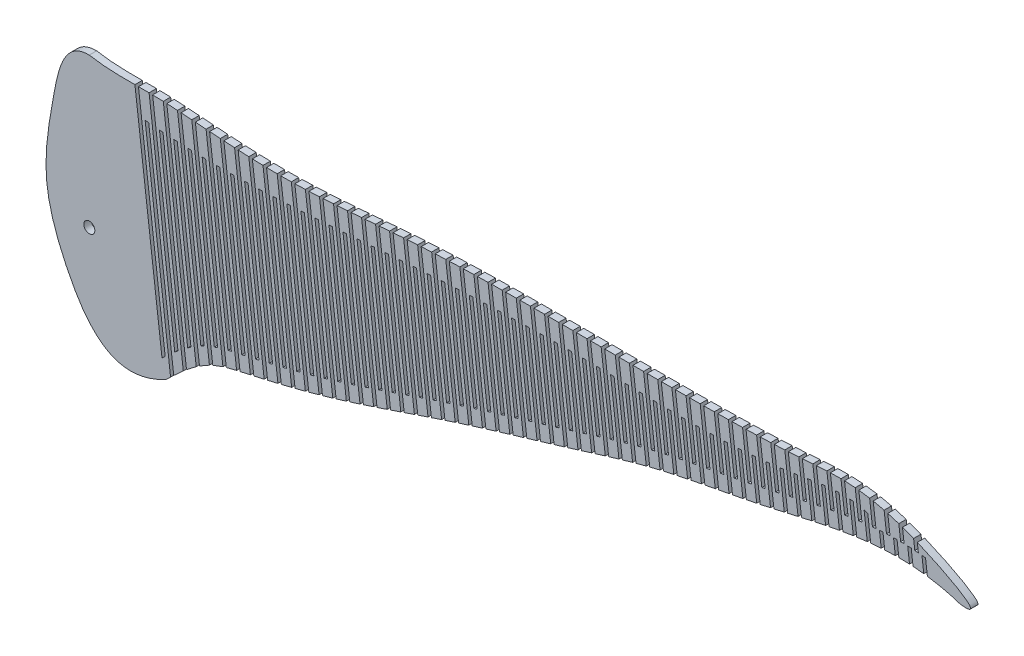
from build123d import *

# Parameters (mm, degrees)
SKETCH1_R           = 2.38125
BOSS_EXTRUDE2_DEPTH = 3.175
CUT_EXTRUDE1_DEPTH  = 3.175


with BuildPart() as part:
    # Sketch1 → Boss-Extrude2 (new body)
    with BuildSketch(Plane.XY):
        with BuildLine():
            add(Edge.make_bspline(
                [(567.133616536, 308.976781927), (556.049720762, 309.088850363), (551.006297343, 282.892582636), (546.011567331, 252.995992895), (559.715290677, 216.0207338), (577.770912474, 191.948620675), (600.425863517, 204.648705491)],
                knots=[0.026328681, 0.026328681, 0.026328681, 0.026328681, 0.228541781, 0.463660912, 0.652574158, 1, 1, 1, 1], degree=3))
            add(Edge.make_bspline(
                [(600.425863517, 204.648705491), (606.781623295, 210.877320821), (616.664473241, 220.057953588), (640.456996715, 225.152133439), (675.352603852, 233.403010618), (721.240078099, 250.37705937), (769.348622462, 264.087135125), (812.906286711, 278.215200159), (869.174422075, 286.967547152), (914.409695051, 301.251815311), (942.415041452, 291.700496238)],
                knots=[0.067185458, 0.067185458, 0.067185458, 0.067185458, 0.134805084, 0.169915234, 0.254868733, 0.416958482, 0.551288566, 0.647146386, 0.774192121, 1, 1, 1, 1], degree=3))
            add(Edge.make_bspline(
                [(571.926765355, 308.281789714), (579.579581369, 307.468207672), (593.751329872, 308.249192648), (620.247053652, 306.20738443), (657.669396644, 303.880172173), (709.434050775, 310.053767806), (762.34393368, 310.422823766), (816.839357789, 310.281113907), (875.350925481, 310.703160442), (908.534484443, 316.105602072), (953.92501491, 290.43791278), (942.415041452, 291.700496238)],
                knots=[0.052792426, 0.052792426, 0.052792426, 0.052792426, 0.110595107, 0.156897127, 0.250721906, 0.388423642, 0.543858019, 0.64145623, 0.800742013, 0.941141889, 1, 1, 1, 1], degree=3))
            add(Edge.make_bspline(
                [(567.133616536, 308.976781927), (568.720016411, 308.678791079), (570.31862519, 308.452753442), (571.926765355, 308.281789714)],
                knots=[0.040645941, 0.040645941, 0.040645941, 0.040645941, 0.052792426, 0.052792426, 0.052792426, 0.052792426], degree=3))
        make_face()
        with Locations((567.133616536, 244.680754038)):
            Circle(SKETCH1_R, mode=Mode.SUBTRACT)
    extrude(amount=BOSS_EXTRUDE2_DEPTH)

    # Sketch3 → Cut-Extrude1 (cut)
    with BuildSketch(Plane.XY.offset(3.175)):
        with BuildLine():
            add(Edge.make_bspline(
                [(602.142246809, 206.319993683), (602.595948617, 206.758229723), (603.050950847, 207.194361823), (603.507686522, 207.62746613)],
                knots=[0.073256466, 0.073256466, 0.073256466, 0.073256466, 0.078055819, 0.078055819, 0.078055819, 0.078055819], degree=3))
            Line((603.507686522, 207.62746613), (592.725859993, 296.53334641))
            add(Edge.make_bspline(
                [(591.184217499, 296.678824721), (591.69816219, 296.628908164), (592.21204252, 296.580423093), (592.725859993, 296.53334641)],
                knots=[0.026743236, 0.026743236, 0.026743236, 0.026743236, 0.031298887, 0.031298887, 0.031298887, 0.031298887], degree=3))
            Line((591.184217499, 296.678824721), (602.142246809, 206.319993683))
        make_face()
        with BuildLine():
            add(Edge.make_bspline(
                [(607.62530827, 211.374224344), (608.083028989, 211.769949648), (608.543600998, 212.160225474), (609.007422193, 212.544202915)],
                knots=[0.092278946, 0.092278946, 0.092278946, 0.092278946, 0.096944838, 0.096944838, 0.096944838, 0.096944838], degree=3))
            Line((609.007422193, 212.544202915), (598.882294984, 296.035005262))
            add(Edge.make_bspline(
                [(597.344670281, 296.147353263), (597.857269495, 296.108576905), (598.369810565, 296.071135232), (598.882294984, 296.035005262)],
                knots=[0.044954335, 0.044954335, 0.044954335, 0.044954335, 0.0495024, 0.0495024, 0.0495024, 0.0495024], degree=3))
            Line((597.344670281, 296.147353263), (607.62530827, 211.374224344))
        make_face()
        with BuildLine():
            add(Edge.make_bspline(
                [(613.191255488, 215.744987207), (613.656684793, 216.069996075), (614.126160625, 216.386952072), (614.600031694, 216.695111227)],
                knots=[0.110657974, 0.110657974, 0.110657974, 0.110657974, 0.115123095, 0.115123095, 0.115123095, 0.115123095], degree=3))
            Line((614.600031694, 216.695111227), (605.023379046, 295.663246352))
            add(Edge.make_bspline(
                [(603.489484543, 295.74483549), (604.000834207, 295.716407857), (604.512131876, 295.689219103), (605.023379046, 295.663246352)],
                knots=[0.063135701, 0.063135701, 0.063135701, 0.063135701, 0.067676586, 0.067676586, 0.067676586, 0.067676586], degree=3))
            Line((603.489484543, 295.74483549), (613.191255488, 215.744987207))
        make_face()
        with BuildLine():
            add(Edge.make_bspline(
                [(618.874083803, 219.151960058), (619.349616894, 219.388924824), (619.829997898, 219.616066295), (620.315522297, 219.832754064)],
                knots=[0.12816668, 0.12816668, 0.12816668, 0.12816668, 0.132391964, 0.132391964, 0.132391964, 0.132391964], degree=3))
            Line((620.315522297, 219.832754064), (611.150252737, 295.408664774))
            add(Edge.make_bspline(
                [(609.619804732, 295.46183443), (610.129999464, 295.442974804), (610.640148303, 295.425259177), (611.150252737, 295.408664774)],
                knots=[0.081288945, 0.081288945, 0.081288945, 0.081288945, 0.085823049, 0.085823049, 0.085823049, 0.085823049], degree=3))
            Line((609.619804732, 295.46183443), (618.874083803, 219.151960058))
        make_face()
        with BuildLine():
            add(Edge.make_bspline(
                [(624.688790483, 221.471476893), (625.175881839, 221.624647193), (625.666299106, 221.770888023), (626.159446234, 221.91134829)],
                knots=[0.144713264, 0.144713264, 0.144713264, 0.144713264, 0.148728365, 0.148728365, 0.148728365, 0.148728365], degree=3))
            Line((626.159446234, 221.91134829), (617.264041737, 295.261978266))
            add(Edge.make_bspline(
                [(615.736760145, 295.289037993), (616.24589336, 295.278975658), (616.75498673, 295.269963309), (617.264041737, 295.261978266)],
                knots=[0.099415656, 0.099415656, 0.099415656, 0.099415656, 0.103943372, 0.103943372, 0.103943372, 0.103943372], degree=3))
            Line((615.736760145, 295.289037993), (624.688790483, 221.471476893))
        make_face()
        with BuildLine():
            add(Edge.make_bspline(
                [(630.59499457, 223.036515114), (631.088674849, 223.150419576), (631.583281191, 223.26204155), (632.078253702, 223.37246025)],
                knots=[0.160613343, 0.160613343, 0.160613343, 0.160613343, 0.164545563, 0.164545563, 0.164545563, 0.164545563], degree=3))
            Line((632.078253702, 223.37246025), (623.365857922, 295.214018406))
            add(Edge.make_bspline(
                [(621.841466011, 295.217250107), (622.34963, 295.215223626), (622.857760146, 295.214153921), (623.365857922, 295.214018406)],
                knots=[0.117517399, 0.117517399, 0.117517399, 0.117517399, 0.122039115, 0.122039115, 0.122039115, 0.122039115], degree=3))
            Line((621.841466011, 295.217250107), (630.59499457, 223.036515114))
        make_face()
        with BuildLine():
            add(Edge.make_bspline(
                [(636.530686339, 224.358400807), (637.025639941, 224.468805635), (637.52020737, 224.579534459), (638.014397418, 224.690619236)],
                knots=[0.17634336, 0.17634336, 0.17634336, 0.17634336, 0.18028597, 0.18028597, 0.18028597, 0.18028597], degree=3))
            Line((638.014397418, 224.690619236), (629.456800396, 295.255722106))
            add(Edge.make_bspline(
                [(627.935024533, 295.237382133), (628.44231055, 295.242638644), (628.949568682, 295.248759469), (629.456800396, 295.255722106)],
                knots=[0.135595719, 0.135595719, 0.135595719, 0.135595719, 0.140111818, 0.140111818, 0.140111818, 0.140111818], degree=3))
            Line((627.935024533, 295.237382133), (636.530686339, 224.358400807))
        make_face()
        with BuildLine():
            add(Edge.make_bspline(
                [(642.46356442, 225.703487898), (642.95802413, 225.817570629), (643.452129386, 225.932109966), (643.945889111, 226.047138347)],
                knots=[0.192144273, 0.192144273, 0.192144273, 0.192144273, 0.196106598, 0.196106598, 0.196106598, 0.196106598], degree=3))
            Line((643.945889111, 226.047138347), (635.537956485, 295.378123375))
            add(Edge.make_bspline(
                [(634.018525888, 295.340444565), (634.525024234, 295.352239101), (635.031500612, 295.36480618), (635.537956485, 295.378123375)],
                knots=[0.153652142, 0.153652142, 0.153652142, 0.153652142, 0.158163004, 0.158163004, 0.158163004, 0.158163004], degree=3))
            Line((634.018525888, 295.340444565), (642.46356442, 225.703487898))
        make_face()
        with BuildLine():
            add(Edge.make_bspline(
                [(648.390350455, 227.098809403), (648.884193158, 227.217571948), (649.377714461, 227.336926041), (649.870923405, 227.456904537)],
                knots=[0.208019657, 0.208019657, 0.208019657, 0.208019657, 0.211998742, 0.211998742, 0.211998742, 0.211998742], degree=3))
            Line((649.870923405, 227.456904537), (641.61040271, 295.572345314))
            add(Edge.make_bspline(
                [(640.093049211, 295.517538968), (640.598849312, 295.535133797), (641.104633326, 295.55341003), (641.61040271, 295.572345314)],
                knots=[0.171688176, 0.171688176, 0.171688176, 0.171688176, 0.176194174, 0.176194174, 0.176194174, 0.176194174], degree=3))
            Line((640.093049211, 295.517538968), (648.390350455, 227.098809403))
        make_face()
        with BuildLine():
            add(Edge.make_bspline(
                [(654.309576904, 228.556466514), (654.802678476, 228.680921075), (655.295492889, 228.806103751), (655.788029274, 228.932047735)],
                knots=[0.223957487, 0.223957487, 0.223957487, 0.223957487, 0.227950244, 0.227950244, 0.227950244, 0.227950244], degree=3))
            Line((655.788029274, 228.932047735), (647.675205735, 295.829592338))
            add(Edge.make_bspline(
                [(646.159663541, 295.759850146), (646.664854028, 295.782514128), (647.170034275, 295.805768955), (647.675205735, 295.829592338)],
                knots=[0.189705313, 0.189705313, 0.189705313, 0.189705313, 0.194206817, 0.194206817, 0.194206817, 0.194206817], degree=3))
            Line((646.159663541, 295.759850146), (654.309576904, 228.556466514))
        make_face()
        with BuildLine():
            add(Edge.make_bspline(
                [(660.219766678, 230.08863915), (660.712002996, 230.219800132), (661.203987404, 230.351826662), (661.695729105, 230.484752196)],
                knots=[0.239945242, 0.239945242, 0.239945242, 0.239945242, 0.243948474, 0.243948474, 0.243948474, 0.243948474], degree=3))
            Line((661.695729105, 230.484752196), (653.733423277, 296.141142603))
            add(Edge.make_bspline(
                [(652.219428748, 296.058638521), (652.724097529, 296.085646482), (653.22876189, 296.113155251), (653.733423277, 296.141142603)],
                knots=[0.207705027, 0.207705027, 0.207705027, 0.207705027, 0.212202405, 0.212202405, 0.212202405, 0.212202405], degree=3))
            Line((652.219428748, 296.058638521), (660.219766678, 230.08863915))
        make_face()
        with BuildLine():
            add(Edge.make_bspline(
                [(666.119445347, 231.707485329), (666.610699454, 231.846357311), (667.101737512, 231.986212865), (667.592568036, 232.127014571)],
                knots=[0.255969995, 0.255969995, 0.255969995, 0.255969995, 0.259980469, 0.259980469, 0.259980469, 0.259980469], degree=3))
            Line((667.592568036, 232.127014571), (659.78610501, 296.49834061))
            add(Edge.make_bspline(
                [(658.273396433, 296.405232691), (658.777630773, 296.435864807), (659.281866484, 296.46690817), (659.78610501, 296.49834061)],
                knots=[0.225688782, 0.225688782, 0.225688782, 0.225688782, 0.230182397, 0.230182397, 0.230182397, 0.230182397], degree=3))
            Line((658.273396433, 296.405232691), (666.119445347, 231.707485329))
        make_face()
        with BuildLine():
            add(Edge.make_bspline(
                [(672.00780096, 233.419700308), (672.498133025, 233.566045917), (672.988282619, 233.713227617), (673.478258291, 233.861207835)],
                knots=[0.272020442, 0.272020442, 0.272020442, 0.272020442, 0.276036411, 0.276036411, 0.276036411, 0.276036411], degree=3))
            Line((673.478258291, 233.861207835), (665.834293437, 296.892589969))
            add(Edge.make_bspline(
                [(664.322610811, 296.791022158), (664.8264974, 296.824563364), (665.330391128, 296.858426674), (665.834293437, 296.892589969)],
                knots=[0.243658026, 0.243658026, 0.243658026, 0.243658026, 0.248148239, 0.248148239, 0.248148239, 0.248148239], degree=3))
            Line((664.322610811, 296.791022158), (672.00780096, 233.419700308))
        make_face()
        with BuildLine():
            add(Edge.make_bspline(
                [(677.886155889, 235.214379944), (678.375712846, 235.366986441), (678.865121212, 235.520280201), (679.354389565, 235.674223521)],
                knots=[0.288091386, 0.288091386, 0.288091386, 0.288091386, 0.292111858, 0.292111858, 0.292111858, 0.292111858], degree=3))
            Line((679.354389565, 235.674223521), (671.879024754, 297.315346322))
            add(Edge.make_bspline(
                [(670.368109575, 297.207450213), (670.8717346, 297.243189608), (671.375372513, 297.279162335), (671.879024754, 297.315346322)],
                knots=[0.261614199, 0.261614199, 0.261614199, 0.261614199, 0.266101366, 0.266101366, 0.266101366, 0.266101366], degree=3))
            Line((670.368109575, 297.207450213), (677.886155889, 235.214379944))
        make_face()
        with BuildLine():
            add(Edge.make_bspline(
                [(683.756285133, 237.076887779), (684.245215716, 237.234527786), (684.734031834, 237.392705129), (685.222742089, 237.551382007)],
                knots=[0.304178844, 0.304178844, 0.304178844, 0.304178844, 0.308202818, 0.308202818, 0.308202818, 0.308202818], degree=3))
            Line((685.222742089, 237.551382007), (677.921329689, 297.758110379))
            add(Edge.make_bspline(
                [(676.410924743, 297.646006946), (676.914373958, 297.68323722), (677.417841794, 297.720612376), (677.921329689, 297.758110379)],
                knots=[0.279558726, 0.279558726, 0.279558726, 0.279558726, 0.284043204, 0.284043204, 0.284043204, 0.284043204], degree=3))
            Line((676.410924743, 297.646006946), (683.756285133, 237.076887779))
        make_face()
        with BuildLine():
            add(Edge.make_bspline(
                [(689.619982999, 238.992428116), (690.108437384, 239.153862606), (690.596811618, 239.315683668), (691.085114316, 239.477853431)],
                knots=[0.320278792, 0.320278792, 0.320278792, 0.320278792, 0.324305256, 0.324305256, 0.324305256, 0.324305256], degree=3))
            Line((691.085114316, 239.477853431), (683.962234336, 298.212421079))
            add(Edge.make_bspline(
                [(682.452083488, 298.098222374), (682.955442284, 298.136239241), (683.458825422, 298.17431281), (683.962234336, 298.212421079)],
                knots=[0.297493026, 0.297493026, 0.297493026, 0.297493026, 0.301975169, 0.301975169, 0.301975169, 0.301975169], degree=3))
            Line((682.452083488, 298.098222374), (689.619982999, 238.992428116))
        make_face()
        with BuildLine():
            add(Edge.make_bspline(
                [(695.479058697, 240.946082395), (695.967188129, 241.110063768), (696.455271847, 241.274280376), (696.943318479, 241.438694307)],
                knots=[0.336387176, 0.336387176, 0.336387176, 0.336387176, 0.340415112, 0.340415112, 0.340415112, 0.340415112], degree=3))
            Line((696.943318479, 241.438694307), (690.002760968, 298.669848845))
            add(Edge.make_bspline(
                [(688.492608964, 298.555659676), (688.995962437, 298.593761313), (689.49934596, 298.631831693), (690.002760968, 298.669848845)],
                knots=[0.315418511, 0.315418511, 0.315418511, 0.315418511, 0.319898669, 0.319898669, 0.319898669, 0.319898669], degree=3))
            Line((688.492608964, 298.555659676), (695.479058697, 240.946082395))
        make_face()
        with BuildLine():
            add(Edge.make_bspline(
                [(701.335331822, 242.922846419), (701.823288231, 243.088121633), (702.311233432, 243.253480442), (702.799176053, 243.41888492)],
                knots=[0.352499919, 0.352499919, 0.352499919, 0.352499919, 0.356528307, 0.356528307, 0.356528307, 0.356528307], degree=3))
            Line((702.799176053, 243.41888492), (696.043928852, 299.121988912))
            add(Edge.make_bspline(
                [(694.533521113, 299.009908506), (695.036954129, 299.047395), (695.540422898, 299.084762451), (696.043928852, 299.121988912)],
                knots=[0.333336582, 0.333336582, 0.333336582, 0.333336582, 0.337815106, 0.337815106, 0.337815106, 0.337815106], degree=3))
            Line((694.533521113, 299.009908506), (701.335331822, 242.922846419))
        make_face()
        with BuildLine():
            add(Edge.make_bspline(
                [(707.190627769, 244.907668161), (707.678563392, 245.072981905), (708.166522315, 245.238227567), (708.654513163, 245.403367237)],
                knots=[0.368612934, 0.368612934, 0.368612934, 0.368612934, 0.372640751, 0.372640751, 0.372640751, 0.372640751], degree=3))
            Line((708.654513163, 245.403367237), (702.086755044, 299.560454738))
            add(Edge.make_bspline(
                [(700.57583747, 299.452578381), (701.079434732, 299.488751179), (701.583073447, 299.524717274), (702.086755044, 299.560454738)],
                knots=[0.351248639, 0.351248639, 0.351248639, 0.351248639, 0.355725876, 0.355725876, 0.355725876, 0.355725876], degree=3))
            Line((700.57583747, 299.452578381), (707.190627769, 244.907668161))
        make_face()
        with BuildLine():
            add(Edge.make_bspline(
                [(713.046773108, 246.885485898), (713.534840099, 247.049583773), (714.022964842, 247.213462122), (714.511155952, 247.377083079)],
                knots=[0.384722132, 0.384722132, 0.384722132, 0.384722132, 0.388748357, 0.388748357, 0.388748357, 0.388748357], degree=3))
            Line((714.511155952, 247.377083079), (708.132255184, 299.97687145))
            add(Edge.make_bspline(
                [(706.620573955, 299.875292122), (707.12442007, 299.909453488), (707.628313337, 299.943320569), (708.132255184, 299.97687145)],
                knots=[0.369156073, 0.369156073, 0.369156073, 0.369156073, 0.373632373, 0.373632373, 0.373632373, 0.373632373], degree=3))
            Line((706.620573955, 299.875292122), (713.046773108, 246.885485898))
        make_face()
        with BuildLine():
            add(Edge.make_bspline(
                [(718.905590957, 248.841266384), (719.393941002, 249.002898078), (719.882383132, 249.164159303), (720.370925946, 249.325012266)],
                knots=[0.400823436, 0.400823436, 0.400823436, 0.400823436, 0.404847052, 0.404847052, 0.404847052, 0.404847052], degree=3))
            Line((720.370925946, 249.325012266), (714.181424061, 300.363036121))
            add(Edge.make_bspline(
                [(712.668743135, 300.269700191), (713.172923248, 300.301173707), (713.677151364, 300.332286084), (714.181424061, 300.363036121)],
                knots=[0.387060282, 0.387060282, 0.387060282, 0.387060282, 0.391536038, 0.391536038, 0.391536038, 0.391536038], degree=3))
            Line((712.668743135, 300.269700191), (718.905590957, 248.841266384))
        make_face()
        with BuildLine():
            add(Edge.make_bspline(
                [(724.768896374, 250.760042814), (724.774452428, 250.761837933), (725.263239723, 250.919755069), (725.752153359, 251.077151126), (726.235627879, 251.232273157)],
                knots=[0.416912786, 0.416912786, 0.416912786, 0.416912786, 0.416958482, 0.420932799, 0.420932799, 0.420932799, 0.420932799], degree=3))
            Line((726.235627879, 251.232273157), (720.234791835, 300.714577096))
            add(Edge.make_bspline(
                [(718.721051807, 300.629974415), (719.225598638, 300.658541704), (719.730179788, 300.686742998), (720.234791835, 300.714577096)],
                knots=[0.40496349, 0.40496349, 0.40496349, 0.40496349, 0.409439579, 0.409439579, 0.409439579, 0.409439579], degree=3))
            Line((718.721051807, 300.629974415), (724.768896374, 250.760042814))
        make_face()
        with BuildLine():
            add(Edge.make_bspline(
                [(730.637993561, 252.631060899), (731.127261963, 252.785078517), (731.616635502, 252.938676519), (732.106108924, 253.09188009)],
                knots=[0.432987192, 0.432987192, 0.432987192, 0.432987192, 0.43700356, 0.43700356, 0.43700356, 0.43700356], degree=3))
            Line((732.106108924, 253.09188009), (726.292426394, 301.030934586))
            add(Edge.make_bspline(
                [(724.777614992, 300.955166351), (725.282532628, 300.98079385), (725.787470904, 301.006050329), (726.292426394, 301.030934586)],
                knots=[0.422869537, 0.422869537, 0.422869537, 0.422869537, 0.427346964, 0.427346964, 0.427346964, 0.427346964], degree=3))
            Line((724.777614992, 300.955166351), (730.637993561, 252.631060899))
        make_face()
        with BuildLine():
            add(Edge.make_bspline(
                [(736.512169325, 254.46020153), (737.001818783, 254.611150124), (737.491552234, 254.761780308), (737.981364437, 254.912117211)],
                knots=[0.449047867, 0.449047867, 0.449047867, 0.449047867, 0.453061155, 0.453061155, 0.453061155, 0.453061155], degree=3))
            Line((737.981364437, 254.912117211), (732.354379283, 301.311683545))
            add(Edge.make_bspline(
                [(730.838483248, 301.244859088), (731.343776129, 301.267510532), (731.849075951, 301.289785752), (732.354379283, 301.311683545)],
                knots=[0.440782453, 0.440782453, 0.440782453, 0.440782453, 0.445262229, 0.445262229, 0.445262229, 0.445262229], degree=3))
            Line((730.838483248, 301.244859088), (736.512169325, 254.46020153))
        make_face()
        with BuildLine():
            add(Edge.make_bspline(
                [(742.390210358, 256.25746953), (742.88014007, 256.406179945), (743.37013273, 256.554672715), (743.860183103, 256.702972921)],
                knots=[0.465097066, 0.465097066, 0.465097066, 0.465097066, 0.469107835, 0.469107835, 0.469107835, 0.469107835], degree=3))
            Line((743.860183103, 256.702972921), (738.420706078, 301.556365713))
            add(Edge.make_bspline(
                [(736.903711131, 301.498602775), (737.409384057, 301.518239102), (737.915050186, 301.537493817), (738.420706078, 301.556365713)],
                knots=[0.458706285, 0.458706285, 0.458706285, 0.458706285, 0.463189425, 0.463189425, 0.463189425, 0.463189425], degree=3))
            Line((736.903711131, 301.498602775), (742.390210358, 256.25746953))
        make_face()
        with BuildLine():
            add(Edge.make_bspline(
                [(748.270910676, 258.032809333), (748.761020383, 258.180108013), (749.251172067, 258.327289471), (749.741360503, 258.474378752)],
                knots=[0.481137026, 0.481137026, 0.481137026, 0.481137026, 0.485145834, 0.485145834, 0.485145834, 0.485145834], degree=3))
            Line((749.741360503, 258.474378752), (744.491466522, 301.76448844))
            add(Edge.make_bspline(
                [(742.973357328, 301.715913477), (743.479415474, 301.732492731), (743.985453022, 301.748684789), (744.491466522, 301.76448844)],
                knots=[0.476645103, 0.476645103, 0.476645103, 0.476645103, 0.48113263, 0.48113263, 0.48113263, 0.48113263], degree=3))
            Line((742.973357328, 301.715913477), (748.270910676, 258.032809333))
        make_face()
        with BuildLine():
            add(Edge.make_bspline(
                [(754.153069918, 259.796118991), (754.643259762, 259.942829141), (755.133470669, 260.089522247), (755.623697419, 260.236223328)],
                knots=[0.497169974, 0.497169974, 0.497169974, 0.497169974, 0.501177376, 0.501177376, 0.501177376, 0.501177376], degree=3))
            Line((755.623697419, 260.236223328), (750.566724691, 301.935523372))
            add(Edge.make_bspline(
                [(749.047484815, 301.896271897), (749.553933746, 301.909749113), (750.060348191, 301.922833342), (750.566724691, 301.935523372)],
                knots=[0.494603015, 0.494603015, 0.494603015, 0.494603015, 0.499095961, 0.499095961, 0.499095961, 0.499095961], degree=3))
            Line((749.047484815, 301.896271897), (754.153069918, 259.796118991))
        make_face()
        with BuildLine():
            add(Edge.make_bspline(
                [(760.035491673, 261.557263994), (760.525662059, 261.704206721), (761.015832629, 261.851232434), (761.505998167, 261.998366136)],
                knots=[0.513198126, 0.513198126, 0.513198126, 0.513198126, 0.517204674, 0.517204674, 0.517204674, 0.517204674], degree=3))
            Line((761.505998167, 261.998366136), (756.646549169, 302.068904975))
            add(Edge.make_bspline(
                [(755.126161032, 302.039121944), (755.633006714, 302.04944902), (756.139803918, 302.059377103), (756.646549169, 302.068904975)],
                knots=[0.512584167, 0.512584167, 0.512584167, 0.512584167, 0.517083577, 0.517083577, 0.517083577, 0.517083577], degree=3))
            Line((755.126161032, 302.039121944), (760.035491673, 261.557263994))
        make_face()
        with BuildLine():
            add(Edge.make_bspline(
                [(765.916981821, 263.326090939), (766.407033279, 263.474086387), (766.897064058, 263.622264801), (767.387068944, 263.770651177)],
                knots=[0.529223691, 0.529223691, 0.529223691, 0.529223691, 0.533229936, 0.533229936, 0.533229936, 0.533229936], degree=3))
            Line((767.387068944, 263.770651177), (762.731013245, 302.164028905))
            add(Edge.make_bspline(
                [(761.209458072, 302.143869139), (761.716706895, 302.150994695), (762.223893117, 302.157715026), (762.731013245, 302.164028905)],
                knots=[0.530592762, 0.530592762, 0.530592762, 0.530592762, 0.535099697, 0.535099697, 0.535099697, 0.535099697], degree=3))
            Line((761.209458072, 302.143869139), (765.916981821, 263.326090939))
        make_face()
        with BuildLine():
            add(Edge.make_bspline(
                [(771.796346886, 265.112441114), (772.286179935, 265.262309595), (772.775971438, 265.412461067), (773.265716178, 265.562920532)],
                knots=[0.545248874, 0.545248874, 0.545248874, 0.545248874, 0.549255369, 0.549255369, 0.549255369, 0.549255369], degree=3))
            Line((773.265716178, 265.562920532), (768.820195137, 302.220250185))
            add(Edge.make_bspline(
                [(767.297452899, 302.209878844), (767.805111696, 302.213748068), (768.312693613, 302.217205592), (768.820195137, 302.220250185)],
                knots=[0.548633067, 0.548633067, 0.548633067, 0.548633067, 0.553148604, 0.553148604, 0.553148604, 0.553148604], degree=3))
            Line((767.297452899, 302.209878844), (771.796346886, 265.112441114))
        make_face()
        with BuildLine():
            add(Edge.make_bspline(
                [(777.67258109, 266.924608054), (778.162156149, 267.076541971), (778.651712969, 267.228612806), (779.141264059, 267.380746807)],
                knots=[0.561275648, 0.561275648, 0.561275648, 0.561275648, 0.565282533, 0.565282533, 0.565282533, 0.565282533], degree=3))
            Line((779.141264059, 267.380746807), (774.914178234, 302.2368812))
            add(Edge.make_bspline(
                [(773.390227585, 302.236474302), (773.898303652, 302.237028774), (774.40628838, 302.237164821), (774.914178234, 302.2368812)],
                knots=[0.566709421, 0.566709421, 0.566709421, 0.566709421, 0.571234659, 0.571234659, 0.571234659, 0.571234659], degree=3))
            Line((773.390227585, 302.236474302), (777.67258109, 266.924608054))
        make_face()
        with BuildLine():
            add(Edge.make_bspline(
                [(783.547257473, 268.749620641), (784.03683065, 268.901452498), (784.526435618, 269.05312631), (785.016084883, 269.20456835)],
                knots=[0.577302782, 0.577302782, 0.577302782, 0.577302782, 0.581309208, 0.581309208, 0.581309208, 0.581309208], degree=3))
            Line((785.016084883, 269.20456835), (781.013051366, 302.213189479))
            add(Edge.make_bspline(
                [(779.487869572, 302.222934477), (779.996370694, 302.220111982), (780.504765811, 302.216864066), (781.013051366, 302.213189479)],
                knots=[0.584826249, 0.584826249, 0.584826249, 0.584826249, 0.589362308, 0.589362308, 0.589362308, 0.589362308], degree=3))
            Line((779.487869572, 302.222934477), (783.547257473, 268.749620641))
        make_face()
        with BuildLine():
            add(Edge.make_bspline(
                [(789.423817397, 270.559101742), (789.913678817, 270.708439367), (790.403621991, 270.85732438), (790.89365941, 271.005683128)],
                knots=[0.59332673, 0.59332673, 0.59332673, 0.59332673, 0.597331798, 0.597331798, 0.597331798, 0.597331798], degree=3))
            Line((790.89365941, 271.005683128), (787.116909096, 302.148395244))
            add(Edge.make_bspline(
                [(785.590471961, 302.168491661), (786.099406437, 302.162225974), (786.608220012, 302.155527588), (787.116909096, 302.148395244)],
                knots=[0.602988075, 0.602988075, 0.602988075, 0.602988075, 0.607536103, 0.607536103, 0.607536103, 0.607536103], degree=3))
            Line((785.590471961, 302.168491661), (789.423817397, 270.559101742))
        make_face()
        with BuildLine():
            add(Edge.make_bspline(
                [(795.305738103, 272.324378352), (795.796177081, 272.46883647), (796.286747624, 272.612548267), (796.777462206, 272.755440215)],
                knots=[0.609343901, 0.609343901, 0.609343901, 0.609343901, 0.613346716, 0.613346716, 0.613346716, 0.613346716], degree=3))
            Line((796.777462206, 272.755440215), (793.225683017, 302.043062578))
            add(Edge.make_bspline(
                [(791.698083829, 302.07274117), (792.207386451, 302.063169219), (792.716582482, 302.053259685), (793.225683017, 302.043062578)],
                knots=[0.621199031, 0.621199031, 0.621199031, 0.621199031, 0.625759014, 0.625759014, 0.625759014, 0.625759014], degree=3))
            Line((791.698083829, 302.07274117), (795.305738103, 272.324378352))
        make_face()
        with BuildLine():
            add(Edge.make_bspline(
                [(801.196483222, 274.016889732), (801.68778761, 274.15409528), (802.179273152, 274.290262113), (802.67095229, 274.425316878)],
                knots=[0.625350719, 0.625350719, 0.625350719, 0.625350719, 0.629350389, 0.629350389, 0.629350389, 0.629350389], degree=3))
            Line((802.67095229, 274.425316878), (799.337827372, 301.90993765))
            add(Edge.make_bspline(
                [(797.809602262, 301.944777535), (798.319069304, 301.933285348), (798.828473958, 301.921655299), (799.337827372, 301.90993765)],
                knots=[0.639451794, 0.639451794, 0.639451794, 0.639451794, 0.644019308, 0.644019308, 0.644019308, 0.644019308], degree=3))
            Line((797.809602262, 301.944777535), (801.196483222, 274.016889732))
        make_face()
        with BuildLine():
            Line((810.771270617, 257.89790452), (805.451006974, 301.768276185))
            add(Edge.make_bspline(
                [(803.922743988, 301.803428389), (804.432179059, 301.791630906), (804.941596331, 301.779896724), (805.451006974, 301.768276185)],
                knots=[0.657727287, 0.657727287, 0.657727287, 0.657727287, 0.662297392, 0.662297392, 0.662297392, 0.662297392], degree=3))
            Line((803.922743988, 301.803428389), (809.298007342, 257.47953453))
            Line((809.298007342, 257.47953453), (810.771270617, 257.89790452))
        make_face()
        with BuildLine():
            add(Edge.make_bspline(
                [(813.017891485, 277.072752379), (813.511660441, 277.189363853), (814.005667499, 277.304733848), (814.499908842, 277.418937078)],
                knots=[0.65731904, 0.65731904, 0.65731904, 0.65731904, 0.661309652, 0.661309652, 0.661309652, 0.661309652], degree=3))
            Line((814.499908842, 277.418937078), (811.562862228, 301.637535155))
            add(Edge.make_bspline(
                [(810.035151576, 301.668132861), (810.544357902, 301.657652496), (811.053591069, 301.647436505), (811.562862228, 301.637535155)],
                knots=[0.676005692, 0.676005692, 0.676005692, 0.676005692, 0.680573419, 0.680573419, 0.680573419, 0.680573419], degree=3))
            Line((810.035151576, 301.668132861), (813.017891485, 277.072752379))
        make_face()
        with BuildLine():
            add(Edge.make_bspline(
                [(818.950926459, 278.416545765), (819.445754452, 278.524254547), (819.940804584, 278.631023521), (820.436073058, 278.736927049)],
                knots=[0.673272422, 0.673272422, 0.673272422, 0.673272422, 0.677256724, 0.677256724, 0.677256724, 0.677256724], degree=3))
            Line((820.436073058, 278.736927049), (817.671040876, 301.537111058))
            add(Edge.make_bspline(
                [(816.14446854, 301.558322327), (816.653251094, 301.550771391), (817.16210484, 301.543684294), (817.671040876, 301.537111058)],
                knots=[0.694267157, 0.694267157, 0.694267157, 0.694267157, 0.698827564, 0.698827564, 0.698827564, 0.698827564], degree=3))
            Line((816.14446854, 301.558322327), (818.950926459, 278.416545765))
        make_face()
        with BuildLine():
            add(Edge.make_bspline(
                [(824.895176445, 279.667861274), (825.39077454, 279.769051953), (825.886578804, 279.86960251), (826.382585461, 279.969586883)],
                knots=[0.689198647, 0.689198647, 0.689198647, 0.689198647, 0.693175365, 0.693175365, 0.693175365, 0.693175365], degree=3))
            Line((826.382585461, 279.969586883), (823.773223348, 301.486130834))
            add(Edge.make_bspline(
                [(822.248364797, 301.493210405), (822.756532387, 301.490173801), (823.264814902, 301.487797403), (823.773223348, 301.486130834)],
                knots=[0.712492015, 0.712492015, 0.712492015, 0.712492015, 0.71704024, 0.71704024, 0.71704024, 0.71704024], degree=3))
            Line((822.248364797, 301.493210405), (824.895176445, 279.667861274))
        make_face()
        with BuildLine():
            Line((834.343483015, 264.591824369), (829.867147193, 301.50325044))
            add(Edge.make_bspline(
                [(828.344561404, 301.491589039), (828.851928651, 301.494607752), (829.35945362, 301.498478528), (829.867147193, 301.50325044)],
                knots=[0.730660992, 0.730660992, 0.730660992, 0.730660992, 0.7351923, 0.7351923, 0.7351923, 0.7351923], degree=3))
            Line((828.344561404, 301.491589039), (832.87021974, 264.173454378))
            Line((832.87021974, 264.173454378), (834.343483015, 264.591824369))
        make_face()
        with BuildLine():
            add(Edge.make_bspline(
                [(836.803521646, 282.006850472), (837.299803059, 282.10207838), (837.796258819, 282.197256972), (838.292885202, 282.292459137)],
                knots=[0.720949494, 0.720949494, 0.720949494, 0.720949494, 0.724907326, 0.724907326, 0.724907326, 0.724907326], degree=3))
            Line((838.292885202, 282.292459137), (835.950629867, 301.606466912))
            add(Edge.make_bspline(
                [(834.430853817, 301.571636678), (834.937242968, 301.582192524), (835.443831408, 301.593786476), (835.950629867, 301.606466912)],
                knots=[0.748755402, 0.748755402, 0.748755402, 0.748755402, 0.753265235, 0.753265235, 0.753265235, 0.753265235], degree=3))
            Line((834.430853817, 301.571636678), (836.803521646, 282.006850472))
        make_face()
        with BuildLine():
            add(Edge.make_bspline(
                [(842.760806386, 283.150682669), (843.25700817, 283.246407573), (843.753368517, 283.342373043), (844.249883738, 283.438651347)],
                knots=[0.736764326, 0.736764326, 0.736764326, 0.736764326, 0.740710915, 0.740710915, 0.740710915, 0.740710915], degree=3))
            Line((844.249883738, 283.438651347), (842.021589281, 301.812948955))
            add(Edge.make_bspline(
                [(840.505133051, 301.750743812), (841.010375581, 301.77024585), (841.515857475, 301.790965047), (842.021589281, 301.812948955)],
                knots=[0.76675733, 0.76675733, 0.76675733, 0.76675733, 0.771241349, 0.771241349, 0.771241349, 0.771241349], degree=3))
            Line((840.505133051, 301.750743812), (842.760806386, 283.150682669))
        make_face()
        with BuildLine():
            Line((852.022642313, 269.612264255), (848.078061603, 302.138890138))
            add(Edge.make_bspline(
                [(846.565404204, 302.045360204), (847.069342175, 302.075133111), (847.573557862, 302.10629422), (848.078061603, 302.138890138)],
                knots=[0.784649791, 0.784649791, 0.784649791, 0.784649791, 0.78910391, 0.78910391, 0.78910391, 0.78910391], degree=3))
            Line((846.565404204, 302.045360204), (850.549379038, 269.193894264))
            Line((850.549379038, 269.193894264), (852.022642313, 269.612264255))
        make_face()
        with BuildLine():
            Line((857.915695413, 271.285744217), (854.118215969, 302.599387572))
            add(Edge.make_bspline(
                [(852.60980197, 302.470866985), (853.112289118, 302.512141614), (853.615090416, 302.554966624), (854.118215969, 302.599387572)],
                knots=[0.80241686, 0.80241686, 0.80241686, 0.80241686, 0.806837279, 0.806837279, 0.806837279, 0.806837279], degree=3))
            Line((852.60980197, 302.470866985), (856.442432138, 270.867374226))
            Line((856.442432138, 270.867374226), (857.915695413, 271.285744217))
        make_face()
        with BuildLine():
            add(Edge.make_bspline(
                [(860.605668362, 286.804754661), (861.10020886, 286.914313605), (861.594853129, 287.024500362), (862.089594186, 287.135202331)],
                knots=[0.783911455, 0.783911455, 0.783911455, 0.783911455, 0.787819312, 0.787819312, 0.787819312, 0.787819312], degree=3))
            Line((862.089594186, 287.135202331), (860.140365914, 303.208347698))
            add(Edge.make_bspline(
                [(858.636602895, 303.041475588), (859.137505441, 303.095381803), (859.638756496, 303.150991034), (860.140365914, 303.208347698)],
                knots=[0.820043784, 0.820043784, 0.820043784, 0.820043784, 0.824427007, 0.824427007, 0.824427007, 0.824427007], degree=3))
            Line((858.636602895, 303.041475588), (860.605668362, 286.804754661))
        make_face()
        with BuildLine():
            add(Edge.make_bspline(
                [(866.539590834, 288.141229827), (867.033851266, 288.25378121), (867.528187254, 288.366509681), (868.022591856, 288.47930332)],
                knots=[0.799529474, 0.799529474, 0.799529474, 0.799529474, 0.803429456, 0.803429456, 0.803429456, 0.803429456], degree=3))
            Line((868.022591856, 288.47930332), (866.142977452, 303.978419605))
            add(Edge.make_bspline(
                [(864.644234295, 303.770154201), (865.143431475, 303.837715998), (865.643009332, 303.9071234), (866.142977452, 303.978419605)],
                knots=[0.837517058, 0.837517058, 0.837517058, 0.837517058, 0.84185991, 0.84185991, 0.84185991, 0.84185991], degree=3))
            Line((864.644234295, 303.770154201), (866.539590834, 288.141229827))
        make_face()
        with BuildLine():
            Line((875.594854711, 276.306184103), (872.125244456, 304.916250531))
            add(Edge.make_bspline(
                [(870.631351599, 304.667990037), (871.129117644, 304.749584341), (871.62713284, 304.832532807), (872.125244456, 304.916250531)],
                knots=[0.854825152, 0.854825152, 0.854825152, 0.854825152, 0.859129492, 0.859129492, 0.859129492, 0.859129492], degree=3))
            Line((870.631351599, 304.667990037), (874.121591436, 275.887814113))
            Line((874.121591436, 275.887814113), (875.594854711, 276.306184103))
        make_face()
        with BuildLine():
            add(Edge.make_bspline(
                [(878.406985717, 290.81789131), (878.901936484, 290.926102662), (879.396907297, 291.033596399), (879.891891218, 291.140260654)],
                knots=[0.830714076, 0.830714076, 0.830714076, 0.830714076, 0.834613473, 0.834613473, 0.834613473, 0.834613473], degree=3))
            Line((879.891891218, 291.140260654), (878.099435143, 305.920677975))
            add(Edge.make_bspline(
                [(876.605295991, 305.674448401), (877.103756929, 305.757710665), (877.601854575, 305.839983506), (878.099435143, 305.920677975)],
                knots=[0.872038376, 0.872038376, 0.872038376, 0.872038376, 0.876352623, 0.876352623, 0.876352623, 0.876352623], degree=3))
            Line((876.605295991, 305.674448401), (878.406985717, 290.81789131))
        make_face()
        with BuildLine():
            add(Edge.make_bspline(
                [(884.350467022, 292.075545267), (884.846391607, 292.176408252), (885.34230844, 292.276101522), (885.838210543, 292.37451258)],
                knots=[0.846320998, 0.846320998, 0.846320998, 0.846320998, 0.850227679, 0.850227679, 0.850227679, 0.850227679], degree=3))
            Line((885.838210543, 292.37451258), (884.090963945, 306.782137033))
            add(Edge.make_bspline(
                [(882.589964939, 306.592473141), (883.091366978, 306.659372883), (883.59175389, 306.722800639), (884.090963945, 306.782137033)],
                knots=[0.889384079, 0.889384079, 0.889384079, 0.889384079, 0.893771374, 0.893771374, 0.893771374, 0.893771374], degree=3))
            Line((882.589964939, 306.592473141), (884.350467022, 292.075545267))
        make_face()
        with BuildLine():
            add(Edge.make_bspline(
                [(890.307224215, 293.223727563), (890.804553118, 293.313704301), (891.301846101, 293.402050513), (891.79909612, 293.488652624)],
                knots=[0.861964744, 0.861964744, 0.861964744, 0.861964744, 0.865883862, 0.865883862, 0.865883862, 0.865883862], degree=3))
            Line((891.79909612, 293.488652624), (890.128777069, 307.261940126))
            add(Edge.make_bspline(
                [(888.61315746, 307.192836281), (889.120206993, 307.222484887), (889.625473066, 307.245747508), (890.128777069, 307.261940126)],
                knots=[0.907128337, 0.907128337, 0.907128337, 0.907128337, 0.911663242, 0.911663242, 0.911663242, 0.911663242], degree=3))
            Line((888.61315746, 307.192836281), (890.307224215, 293.223727563))
        make_face()
        with BuildLine():
            add(Edge.make_bspline(
                [(896.282482927, 294.219348158), (896.781662445, 294.294777167), (897.280777239, 294.368101687), (897.77982017, 294.439206591)],
                knots=[0.877666155, 0.877666155, 0.877666155, 0.877666155, 0.88160303, 0.88160303, 0.88160303, 0.88160303], degree=3))
            Line((897.77982017, 294.439206591), (896.250142303, 307.052780737))
            add(Edge.make_bspline(
                [(894.709382611, 307.190979548), (895.22583371, 307.155389253), (895.739490173, 307.109590674), (896.250142303, 307.052780737)],
                knots=[0.925603374, 0.925603374, 0.925603374, 0.925603374, 0.93038744, 0.93038744, 0.93038744, 0.93038744], degree=3))
            Line((894.709382611, 307.190979548), (896.282482927, 294.219348158))
        make_face()
        with BuildLine():
            add(Edge.make_bspline(
                [(902.281683372, 295.017547615), (902.783182038, 295.074591305), (903.28458625, 295.129038547), (903.785888741, 295.180772158)],
                knots=[0.893446846, 0.893446846, 0.893446846, 0.893446846, 0.897407038, 0.897407038, 0.897407038, 0.897407038], degree=3))
            Line((903.785888741, 295.180772158), (902.510876001, 305.694402703))
            add(Edge.make_bspline(
                [(900.928338608, 306.177096332), (901.460252311, 306.032471058), (901.987854245, 305.871915817), (902.510876001, 305.694402703)],
                knots=[0.945289629, 0.945289629, 0.945289629, 0.945289629, 0.950483968, 0.950483968, 0.950483968, 0.950483968], degree=3))
            Line((900.928338608, 306.177096332), (902.281683372, 295.017547615))
        make_face()
        with BuildLine():
            add(Edge.make_bspline(
                [(908.310560625, 295.571033573), (908.81487649, 295.605619042), (909.319066923, 295.637092698), (909.823124494, 295.665334747)],
                knots=[0.909329518, 0.909329518, 0.909329518, 0.909329518, 0.913318913, 0.913318913, 0.913318913, 0.913318913], degree=3))
            Line((909.823124494, 295.665334747), (909.057123698, 301.981701628))
            add(Edge.make_bspline(
                [(907.545088559, 301.883040603), (908.048722812, 301.918859438), (908.552735916, 301.951785559), (909.057123698, 301.981701628)],
                knots=[0.901908809, 0.901908809, 0.901908809, 0.901908809, 0.905972757, 0.905972757, 0.905972757, 0.905972757], degree=3))
            Line((907.545088559, 301.883040603), (908.310560626, 295.571033573))
        make_face()
        with BuildLine():
            add(Edge.make_bspline(
                [(914.375237238, 295.829322999), (914.882906333, 295.837073401), (915.390417405, 295.841167024), (915.897762823, 295.841480846)],
                knots=[0.925338321, 0.925338321, 0.925338321, 0.925338321, 0.929363231, 0.929363231, 0.929363231, 0.929363231], degree=3))
            Line((915.897762823, 295.841480846), (915.128063977, 302.18834148))
            add(Edge.make_bspline(
                [(913.606730915, 302.166350213), (914.113503827, 302.177102604), (914.620618955, 302.184473866), (915.128063977, 302.18834148)],
                knots=[0.918165204, 0.918165204, 0.918165204, 0.918165204, 0.922230944, 0.922230944, 0.922230944, 0.922230944], degree=3))
            Line((913.606730915, 302.166350213), (914.375237238, 295.829322999))
        make_face()
        with BuildLine():
            add(Edge.make_bspline(
                [(920.482329957, 295.73785341), (920.993936374, 295.714006374), (921.50535014, 295.685920748), (922.016563379, 295.653469583)],
                knots=[0.941499274, 0.941499274, 0.941499274, 0.941499274, 0.945566552, 0.945566552, 0.945566552, 0.945566552], degree=3))
            Line((922.016563379, 295.653469583), (921.239827433, 302.058357444))
            add(Edge.make_bspline(
                [(919.7077338, 302.125096793), (920.091179383, 302.111336161), (920.47479098, 302.09538112), (920.985633727, 302.071152631), (921.1127219, 302.064879279), (921.239827433, 302.058357444)],
                knots=[0.934439046, 0.934439046, 0.934439046, 0.934439046, 0.9375, 0.9375, 0.938513509, 0.938513509, 0.938513509, 0.938513509], degree=3))
            Line((919.7077338, 302.125096793), (920.482329957, 295.73785341))
        make_face()
        with BuildLine():
            add(Edge.make_bspline(
                [(926.639079864, 295.23691555), (927.155268042, 295.176223972), (927.671226396, 295.110666502), (928.186946758, 295.040111459)],
                knots=[0.957840767, 0.957840767, 0.957840767, 0.957840767, 0.961957952, 0.961957952, 0.961957952, 0.961957952], degree=3))
            Line((928.186946758, 295.040111459), (927.398527762, 301.541336594))
            add(Edge.make_bspline(
                [(925.854099333, 301.709787455), (926.368716945, 301.658100606), (926.883535552, 301.601991719), (927.398527762, 301.541336594)],
                knots=[0.950759613, 0.950759613, 0.950759613, 0.950759613, 0.9548515, 0.9548515, 0.9548515, 0.9548515], degree=3))
            Line((925.854099333, 301.709787455), (926.639079864, 295.23691555))
        make_face()
        with BuildLine():
            add(Edge.make_bspline(
                [(923.865155961, 305.543667377), (923.325057107, 305.766556501), (922.790854119, 305.983069545), (922.262365133, 306.193368836)],
                knots=[0.109805157, 0.109805157, 0.109805157, 0.109805157, 0.112900014, 0.112900014, 0.112900014, 0.112900014], degree=3))
            Line((922.262365133, 306.193368836), (922.774852944, 301.967444765))
            add(Edge.make_bspline(
                [(922.774852944, 301.967444765), (923.287293145, 301.933002784), (923.799987764, 301.894407237), (924.31290961, 301.851534843)],
                knots=[0.942591312, 0.942591312, 0.942591312, 0.942591312, 0.946673117, 0.946673117, 0.946673117, 0.946673117], degree=3))
            Line((924.31290961, 301.851534843), (923.865155961, 305.543667377))
        make_face()
        with BuildLine():
            add(Edge.make_bspline(
                [(917.472883947, 307.986697416), (916.936980275, 308.174233674), (916.407118668, 308.355069468), (915.883067754, 308.529411314)],
                knots=[0.122564664, 0.122564664, 0.122564664, 0.122564664, 0.125918141, 0.125918141, 0.125918141, 0.125918141], degree=3))
            Line((915.883067754, 308.529411314), (916.651947343, 302.189305867))
            add(Edge.make_bspline(
                [(916.651947343, 302.189305867), (917.160475112, 302.186038154), (917.66932099, 302.179138015), (918.178472624, 302.168482614)],
                knots=[0.926298205, 0.926298205, 0.926298205, 0.926298205, 0.930367426, 0.930367426, 0.930367426, 0.930367426], degree=3))
            Line((918.178472624, 302.168482614), (917.472883947, 307.986697416))
        make_face()
        with BuildLine():
            add(Edge.make_bspline(
                [(911.135227591, 309.979372114), (910.604333949, 310.126489295), (910.079412784, 310.266740822), (909.560169842, 310.400389338)],
                knots=[0.136393276, 0.136393276, 0.136393276, 0.136393276, 0.140026569, 0.140026569, 0.140026569, 0.140026569], degree=3))
            Line((909.560169842, 310.400389338), (910.571350799, 302.062290652))
            add(Edge.make_bspline(
                [(910.571350799, 302.062290652), (911.076490385, 302.086062978), (911.581996513, 302.106701806), (912.087856875, 302.124084773)],
                knots=[0.910036546, 0.910036546, 0.910036546, 0.910036546, 0.91410055, 0.91410055, 0.91410055, 0.91410055], degree=3))
            Line((912.087856875, 302.124084773), (911.135227591, 309.979372114))
        make_face()
        with BuildLine():
            add(Edge.make_bspline(
                [(904.858928693, 311.466099256), (904.333883119, 311.568606079), (903.814378048, 311.664381359), (903.300044022, 311.75375486)],
                knots=[0.151357495, 0.151357495, 0.151357495, 0.151357495, 0.155277139, 0.155277139, 0.155277139, 0.155277139], degree=3))
            Line((903.300044022, 311.75375486), (904.527254789, 301.634295622))
            add(Edge.make_bspline(
                [(904.527254789, 301.634295622), (905.029503965, 301.681231852), (905.532140565, 301.725508532), (906.035160413, 301.767008219)],
                knots=[0.893779271, 0.893779271, 0.893779271, 0.893779271, 0.897844412, 0.897844412, 0.897844412, 0.897844412], degree=3))
            Line((906.035160413, 301.767008219), (904.858928693, 311.466099256))
        make_face()
        with BuildLine():
            add(Edge.make_bspline(
                [(898.648351493, 312.410891742), (898.129807705, 312.467255996), (897.615848975, 312.517492499), (897.10602596, 312.562002321)],
                knots=[0.167445409, 0.167445409, 0.167445409, 0.167445409, 0.171629344, 0.171629344, 0.171629344, 0.171629344], degree=3))
            Line((897.10602596, 312.562002321), (898.514208879, 300.95026452))
            add(Edge.make_bspline(
                [(898.514208879, 300.95026452), (899.014018077, 301.01670946), (899.514232596, 301.080958601), (900.014848243, 301.142893985)],
                knots=[0.877505353, 0.877505353, 0.877505353, 0.877505353, 0.88157643, 0.88157643, 0.88157643, 0.88157643], degree=3))
            Line((900.014848243, 301.142893985), (898.648351493, 312.410891742))
        make_face()
        with BuildLine():
            Line((890.590951568, 316.017648688), (892.526954293, 300.0535607))
            add(Edge.make_bspline(
                [(892.526954293, 300.0535607), (893.024766299, 300.135950412), (893.522992405, 300.21658903), (894.021630002, 300.295365875)],
                knots=[0.861196324, 0.861196324, 0.861196324, 0.861196324, 0.865277793, 0.865277793, 0.865277793, 0.865277793], degree=3))
            Line((894.021630002, 300.295365875), (892.112552875, 316.037428036))
            Line((892.112552875, 316.037428036), (890.590951568, 316.017648688))
        make_face()
        with BuildLine():
            Line((884.504546341, 315.938531299), (886.560484043, 298.985471289))
            add(Edge.make_bspline(
                [(886.560484043, 298.985471289), (887.056702062, 299.080459755), (887.553347674, 299.174131441), (888.050418245, 299.266374472)],
                knots=[0.844835314, 0.844835314, 0.844835314, 0.844835314, 0.848931375, 0.848931375, 0.848931375, 0.848931375], degree=3))
            Line((888.050418245, 299.266374472), (886.026147648, 315.958310646))
            Line((886.026147648, 315.958310646), (884.504546341, 315.938531299))
        make_face()
        with BuildLine():
            Line((878.418141114, 315.859413909), (880.609938973, 297.786064412))
            add(Edge.make_bspline(
                [(880.609938973, 297.786064412), (881.104967857, 297.890297551), (881.600438979, 297.993654592), (882.096349666, 298.0960221)],
                knots=[0.828405011, 0.828405011, 0.828405011, 0.828405011, 0.832520056, 0.832520056, 0.832520056, 0.832520056], degree=3))
            Line((882.096349666, 298.0960221), (879.939742421, 315.879193257))
            Line((879.939742421, 315.879193257), (878.418141114, 315.859413909))
        make_face()
        with BuildLine():
            add(Edge.make_bspline(
                [(874.317967721, 311.968778257), (874.045922024, 311.948629134), (873.543862461, 311.911903581), (873.03848391, 311.876027387), (872.80718006, 311.859830654)],
                knots=[0.237586218, 0.237586218, 0.237586218, 0.237586218, 0.239903928, 0.241849369, 0.241849369, 0.241849369, 0.241849369], degree=3))
            Line((872.80718006, 311.859830654), (874.670401677, 296.495888522))
            add(Edge.make_bspline(
                [(874.670401677, 296.495888522), (874.743564917, 296.512181837), (874.816738265, 296.528465604), (875.311124966, 296.638402801), (875.732660506, 296.731744805), (876.154526639, 296.82469412)],
                knots=[0.811887365, 0.811887365, 0.811887365, 0.811887365, 0.8125, 0.8125, 0.816025986, 0.816025986, 0.816025986, 0.816025986], degree=3))
            Line((876.154526639, 296.82469412), (874.317967721, 311.968778257))
        make_face()
        with BuildLine():
            Line((866.24533066, 315.70117913), (868.73696053, 295.155444373))
            add(Edge.make_bspline(
                [(868.73696053, 295.155444373), (869.230819258, 295.268029989), (869.725172053, 295.380618849), (870.220012305, 295.493099369)],
                knots=[0.795262585, 0.795262585, 0.795262585, 0.795262585, 0.799430054, 0.799430054, 0.799430054, 0.799430054], degree=3))
            Line((870.220012305, 295.493099369), (867.766931967, 315.720958478))
            Line((867.766931967, 315.720958478), (866.24533066, 315.70117913))
        make_face()
        with BuildLine():
            add(Edge.make_bspline(
                [(862.212717527, 311.25344822), (861.709536662, 311.230258693), (861.204245944, 311.207669934), (860.69693762, 311.185666181)],
                knots=[0.270417625, 0.270417625, 0.270417625, 0.270417625, 0.274351063, 0.274351063, 0.274351063, 0.274351063], degree=3))
            Line((860.69693762, 311.185666181), (862.804742534, 293.80491425))
            add(Edge.make_bspline(
                [(862.804742534, 293.80491425), (863.127054418, 293.877802742), (863.449593171, 293.950885423), (863.944159787, 294.063119317), (864.116026727, 294.102153796), (864.287956733, 294.141229913)],
                knots=[0.778507472, 0.778507472, 0.778507472, 0.778507472, 0.78125, 0.78125, 0.782709821, 0.782709821, 0.782709821, 0.782709821], degree=3))
            Line((864.287956733, 294.141229913), (862.212717527, 311.25344822))
        make_face()
        with BuildLine():
            add(Edge.make_bspline(
                [(856.14679468, 311.005435144), (855.642559442, 310.987264372), (855.136673585, 310.969602913), (854.629221984, 310.952436264)],
                knots=[0.285980399, 0.285980399, 0.285980399, 0.285980399, 0.289806123, 0.289806123, 0.289806123, 0.289806123], degree=3))
            Line((854.629221984, 310.952436264), (856.86867841, 292.486098916))
            add(Edge.make_bspline(
                [(856.86867841, 292.486098916), (857.33795363, 292.587861799), (857.807657086, 292.690431342), (858.303144451, 292.799365121), (858.328245835, 292.804885472), (858.353348687, 292.810407897)],
                knots=[0.761595143, 0.761595143, 0.761595143, 0.761595143, 0.765625, 0.765625, 0.765840033, 0.765840033, 0.765840033, 0.765840033], degree=3))
            Line((858.353348687, 292.810407897), (856.14679468, 311.005435144))
        make_face()
        with BuildLine():
            Line((847.986114979, 315.463826962), (850.924288698, 291.23593556))
            add(Edge.make_bspline(
                [(850.924288698, 291.23593556), (851.420089909, 291.337124779), (851.915738502, 291.438956503), (852.411231714, 291.541503764)],
                knots=[0.744564659, 0.744564659, 0.744564659, 0.744564659, 0.748822068, 0.748822068, 0.748822068, 0.748822068], degree=3))
            Line((852.411231714, 291.541503764), (849.507716286, 315.483606309))
            Line((849.507716286, 315.483606309), (847.986114979, 315.463826962))
        make_face()
        with BuildLine():
            add(Edge.make_bspline(
                [(843.996152404, 310.664403752), (843.490289449, 310.653743262), (842.983512956, 310.643449913), (842.475898879, 310.633510725)],
                knots=[0.31604103, 0.31604103, 0.31604103, 0.31604103, 0.31972776, 0.31972776, 0.31972776, 0.31972776], degree=3))
            Line((842.475898879, 310.633510725), (844.972260612, 290.048757491))
            add(Edge.make_bspline(
                [(844.972260612, 290.048757491), (845.46858283, 290.145849298), (845.964763844, 290.243290794), (846.460800903, 290.341154721)],
                knots=[0.727548546, 0.727548546, 0.727548546, 0.727548546, 0.731800345, 0.731800345, 0.731800345, 0.731800345], degree=3))
            Line((846.460800903, 290.341154721), (843.996152404, 310.664403752))
        make_face()
        with BuildLine():
            add(Edge.make_bspline(
                [(837.913579554, 310.553684954), (837.407069198, 310.545827072), (836.899960681, 310.538277986), (836.39232757, 310.531025127)],
                knots=[0.330723687, 0.330723687, 0.330723687, 0.330723687, 0.334371353, 0.334371353, 0.334371353, 0.334371353], degree=3))
            Line((836.39232757, 310.531025127), (839.015941186, 288.896965387))
            add(Edge.make_bspline(
                [(839.015941186, 288.896965387), (839.512504926, 288.992262277), (840.008938899, 289.087617983), (840.505240367, 289.18310488)],
                knots=[0.710558871, 0.710558871, 0.710558871, 0.710558871, 0.714803463, 0.714803463, 0.714803463, 0.714803463], degree=3))
            Line((840.505240367, 289.18310488), (837.913579554, 310.553684954))
        make_face()
        with BuildLine():
            add(Edge.make_bspline(
                [(831.827293886, 310.473581693), (831.320214715, 310.46802095), (830.812834499, 310.462715781), (830.3052255, 310.457653836)],
                knots=[0.345276591, 0.345276591, 0.345276591, 0.345276591, 0.348902569, 0.348902569, 0.348902569, 0.348902569], degree=3))
            Line((830.3052255, 310.457653836), (833.058666607, 287.753049377))
            add(Edge.make_bspline(
                [(833.058666607, 287.753049377), (833.555194861, 287.84883294), (834.051604774, 287.944387142), (834.547893627, 288.03978391)],
                knots=[0.693601951, 0.693601951, 0.693601951, 0.693601951, 0.697837769, 0.697837769, 0.697837769, 0.697837769], degree=3))
            Line((834.547893627, 288.03978391), (831.827293886, 310.473581693))
        make_face()
        with BuildLine():
            add(Edge.make_bspline(
                [(825.737989564, 310.418369958), (825.230403258, 310.414660186), (824.722804732, 310.411156032), (824.215265931, 310.407845202)],
                knots=[0.359767492, 0.359767492, 0.359767492, 0.359767492, 0.363388156, 0.363388156, 0.363388156, 0.363388156], degree=3))
            Line((824.215265931, 310.407845202), (827.103743725, 286.589741506))
            add(Edge.make_bspline(
                [(827.103743725, 286.589741506), (827.599957373, 286.688288134), (828.096068402, 286.786311683), (828.592072003, 286.883886977)],
                knots=[0.676683964, 0.676683964, 0.676683964, 0.676683964, 0.680909494, 0.680909494, 0.680909494, 0.680909494], degree=3))
            Line((828.592072003, 286.883886977), (825.737989564, 310.418369958))
        make_face()
        with BuildLine():
            add(Edge.make_bspline(
                [(819.646289339, 310.382914601), (819.138244098, 310.380647266), (818.630476288, 310.378537268), (818.123058501, 310.376572203)],
                knots=[0.374261303, 0.374261303, 0.374261303, 0.374261303, 0.377892789, 0.377892789, 0.377892789, 0.377892789], degree=3))
            Line((818.123058501, 310.376572203), (821.154528418, 285.379369534))
            add(Edge.make_bspline(
                [(821.154528418, 285.379369534), (821.650140862, 285.483005942), (822.145670351, 285.585824913), (822.641112113, 285.687900666)],
                knots=[0.659810091, 0.659810091, 0.659810091, 0.659810091, 0.664024193, 0.664024193, 0.664024193, 0.664024193], degree=3))
            Line((822.641112113, 285.687900666), (819.646289339, 310.382914601))
        make_face()
        with BuildLine():
            add(Edge.make_bspline(
                [(813.552773678, 310.362429151), (813.044306293, 310.361215048), (812.536416048, 310.360110172), (812.029177194, 310.359101833)],
                knots=[0.38882307, 0.38882307, 0.38882307, 0.38882307, 0.392482003, 0.392482003, 0.392482003, 0.392482003], degree=3))
            Line((812.029177194, 310.359101833), (815.214385456, 284.094187901))
            add(Edge.make_bspline(
                [(815.214385456, 284.094187901), (815.709118416, 284.205206091), (816.203787852, 284.315117081), (816.698389032, 284.423994433)],
                knots=[0.642984493, 0.642984493, 0.642984493, 0.642984493, 0.647186145, 0.647186145, 0.647186145, 0.647186145], degree=3))
            Line((816.698389032, 284.423994433), (813.552773678, 310.362429151))
        make_face()
        with BuildLine():
            add(Edge.make_bspline(
                [(807.458005053, 310.352275521), (806.949311969, 310.35173829), (806.441381439, 310.351269643), (805.934176225, 310.350864088)],
                knots=[0.403520511, 0.403520511, 0.403520511, 0.403520511, 0.407222423, 0.407222423, 0.407222423, 0.407222423], degree=3))
            Line((805.934176225, 310.350864088), (809.286613859, 282.7069932))
            add(Edge.make_bspline(
                [(809.286613859, 282.7069932), (809.780194911, 282.8276367), (810.273731605, 282.946888276), (810.767219256, 283.064820788)],
                knots=[0.626211174, 0.626211174, 0.626211174, 0.626211174, 0.630399388, 0.630399388, 0.630399388, 0.630399388], degree=3))
            Line((810.767219256, 283.064820788), (807.458005053, 310.352275521))
        make_face()
        with BuildLine():
            add(Edge.make_bspline(
                [(801.362430743, 310.348765483), (800.853820901, 310.348689821), (800.345837363, 310.348661696), (799.838441668, 310.348675436)],
                knots=[0.418390638, 0.418390638, 0.418390638, 0.418390638, 0.422132589, 0.422132589, 0.422132589, 0.422132589], degree=3))
            Line((799.838441668, 310.348675436), (803.374053079, 281.194371606))
            add(Edge.make_bspline(
                [(803.374053079, 281.194371606), (803.865668673, 281.325526153), (804.35794779, 281.455579827), (804.850748817, 281.584437854)],
                knots=[0.609452049, 0.609452049, 0.609452049, 0.609452049, 0.613648596, 0.613648596, 0.613648596, 0.613648596], degree=3))
            Line((804.850748817, 281.584437854), (801.362430743, 310.348765483))
        make_face()
        with BuildLine():
            add(Edge.make_bspline(
                [(795.266307122, 310.349785011), (794.757811194, 310.350001399), (794.249795283, 310.350242984), (793.74221994, 310.35050395)],
                knots=[0.433408924, 0.433408924, 0.433408924, 0.433408924, 0.437182742, 0.437182742, 0.437182742, 0.437182742], degree=3))
            Line((793.74221994, 310.35050395), (797.475657778, 279.564942865))
            add(Edge.make_bspline(
                [(797.475657778, 279.564942865), (797.609083976, 279.602962814), (797.742543572, 279.640920531), (798.233482263, 279.780280733), (798.591169221, 279.881289885), (798.949102871, 279.981813617)],
                knots=[0.592602158, 0.592602158, 0.592602158, 0.592602158, 0.59375, 0.59375, 0.596823494, 0.596823494, 0.596823494, 0.596823494], degree=3))
            Line((798.949102871, 279.981813617), (795.266307122, 310.349785011))
        make_face()
        with BuildLine():
            add(Edge.make_bspline(
                [(789.169889545, 310.353228481), (788.661537554, 310.353555385), (788.153511313, 310.353884182), (787.645770646, 310.354208948)],
                knots=[0.448541496, 0.448541496, 0.448541496, 0.448541496, 0.452338253, 0.452338253, 0.452338253, 0.452338253], degree=3))
            Line((787.645770646, 310.354208948), (791.588201319, 277.845313509))
            add(Edge.make_bspline(
                [(791.588201319, 277.845313509), (792.078132581, 277.991523075), (792.568467626, 278.137174594), (793.059219697, 278.282194711)],
                knots=[0.575659063, 0.575659063, 0.575659063, 0.575659063, 0.579903402, 0.579903402, 0.579903402, 0.579903402], degree=3))
            Line((793.059219697, 278.282194711), (789.169889545, 310.353228481))
        make_face()
        with BuildLine():
            add(Edge.make_bspline(
                [(783.073448245, 310.356867561), (782.565268657, 310.357115427), (782.057255043, 310.357341297), (781.549366801, 310.357539183)],
                knots=[0.463751724, 0.463751724, 0.463751724, 0.463751724, 0.467561923, 0.467561923, 0.467561923, 0.467561923], degree=3))
            Line((781.549366801, 310.357539183), (785.708369359, 276.06281329))
            add(Edge.make_bspline(
                [(785.708369359, 276.06281329), (786.152794447, 276.199278677), (786.597512217, 276.335523034), (787.087617385, 276.485266997), (787.13270581, 276.499039285), (787.177797347, 276.512808687)],
                knots=[0.558625943, 0.558625943, 0.558625943, 0.558625943, 0.5625, 0.5625, 0.562892484, 0.562892484, 0.562892484, 0.562892484], degree=3))
            Line((787.177797347, 276.512808687), (783.073448245, 310.356867561))
        make_face()
        with BuildLine():
            add(Edge.make_bspline(
                [(776.977262084, 310.358402793), (776.469280932, 310.358378664), (775.961303259, 310.35830849), (775.453288347, 310.358186265)],
                knots=[0.479001029, 0.479001029, 0.479001029, 0.479001029, 0.48281483, 0.48281483, 0.48281483, 0.48281483], degree=3))
            Line((775.453288347, 310.358186265), (779.832773092, 274.245385952))
            add(Edge.make_bspline(
                [(779.832773092, 274.245385952), (780.322024028, 274.397417031), (780.811582667, 274.549472278), (781.301461748, 274.701477817)],
                knots=[0.541505933, 0.541505933, 0.541505933, 0.541505933, 0.545793926, 0.545793926, 0.545793926, 0.545793926], degree=3))
            Line((781.301461748, 274.701477817), (776.977262084, 310.358402793))
        make_face()
        with BuildLine():
            add(Edge.make_bspline(
                [(770.88161156, 310.35552121), (770.543134345, 310.355196223), (770.035268059, 310.354662155), (769.52721597, 310.354054282), (769.357815108, 310.353842812)],
                knots=[0.494249829, 0.494249829, 0.494249829, 0.494249829, 0.496787922, 0.498057302, 0.498057302, 0.498057302, 0.498057302], degree=3))
            Line((769.357815108, 310.353842812), (773.957966124, 272.421450142))
            add(Edge.make_bspline(
                [(773.957966124, 272.421450142), (774.447333814, 272.572829643), (774.936900805, 272.724504992), (775.426787452, 272.876448002)],
                knots=[0.524300592, 0.524300592, 0.524300592, 0.524300592, 0.528610308, 0.528610308, 0.528610308, 0.528610308], degree=3))
            Line((775.426787452, 272.876448002), (770.88161156, 310.35552121))
        make_face()
        with BuildLine():
            add(Edge.make_bspline(
                [(764.786818539, 310.34556867), (764.279147484, 310.344316218), (763.77131334, 310.342936196), (763.263322588, 310.341412373)],
                knots=[0.509462761, 0.509462761, 0.509462761, 0.509462761, 0.51325914, 0.51325914, 0.51325914, 0.51325914], degree=3))
            Line((763.263322588, 310.341412373), (768.080728971, 270.61755263))
            add(Edge.make_bspline(
                [(768.080728971, 270.61755263), (768.570743062, 270.766768428), (769.060621125, 270.916205825), (769.55035805, 271.06588986)],
                knots=[0.507042795, 0.507042795, 0.507042795, 0.507042795, 0.511356031, 0.511356031, 0.511356031, 0.511356031], degree=3))
            Line((769.55035805, 271.06588986), (764.786818539, 310.34556867))
        make_face()
        with BuildLine():
            add(Edge.make_bspline(
                [(758.693506075, 310.323407682), (758.18597043, 310.320883156), (757.678298309, 310.318167206), (757.170496143, 310.315243727)],
                knots=[0.524632972, 0.524632972, 0.524632972, 0.524632972, 0.528419388, 0.528419388, 0.528419388, 0.528419388], degree=3))
            Line((757.170496143, 310.315243727), (762.200552459, 268.837893564))
            add(Edge.make_bspline(
                [(762.200552459, 268.837893564), (762.690755384, 268.985484586), (763.180842627, 269.133197611), (763.670808852, 269.281058017)],
                knots=[0.489808028, 0.489808028, 0.489808028, 0.489808028, 0.49411406, 0.49411406, 0.49411406, 0.49411406], degree=3))
            Line((763.670808852, 269.281058017), (758.693506075, 310.323407682))
        make_face()
        with BuildLine():
            add(Edge.make_bspline(
                [(752.602413617, 310.282940747), (752.095074957, 310.278639038), (751.58762603, 310.274082736), (751.080073222, 310.269255847)],
                knots=[0.539765049, 0.539765049, 0.539765049, 0.539765049, 0.54354264, 0.54354264, 0.54354264, 0.54354264], degree=3))
            Line((751.080073222, 310.269255847), (756.318616487, 267.072742848))
            add(Edge.make_bspline(
                [(756.318616487, 267.072742848), (756.808906524, 267.21953885), (757.299102484, 267.366355373), (757.789199056, 267.513217677)],
                knots=[0.472600593, 0.472600593, 0.472600593, 0.472600593, 0.476900028, 0.476900028, 0.476900028, 0.476900028], degree=3))
            Line((757.789199056, 267.513217677), (752.602413617, 310.282940747))
        make_face()
        with BuildLine():
            add(Edge.make_bspline(
                [(746.514272349, 310.218138584), (746.007191586, 310.211559711), (745.50002642, 310.204663624), (744.992783196, 310.197434427)],
                knots=[0.554863504, 0.554863504, 0.554863504, 0.554863504, 0.558633384, 0.558633384, 0.558633384, 0.558633384], degree=3))
            Line((744.992783196, 310.197434427), (750.436132855, 265.312108078))
            add(Edge.make_bspline(
                [(750.436132855, 265.312108078), (750.926409363, 265.458939709), (751.416613216, 265.60569112), (751.906739126, 265.752387468)],
                knots=[0.455417952, 0.455417952, 0.455417952, 0.455417952, 0.459711426, 0.459711426, 0.459711426, 0.459711426], degree=3))
            Line((751.906739126, 265.752387468), (746.514272349, 310.218138584))
        make_face()
        with BuildLine():
            add(Edge.make_bspline(
                [(740.429807001, 310.123025145), (739.923044567, 310.113672774), (739.4162233, 310.10394099), (738.909349513, 310.093813983)],
                knots=[0.569932753, 0.569932753, 0.569932753, 0.569932753, 0.573696011, 0.573696011, 0.573696011, 0.573696011], degree=3))
            Line((738.909349513, 310.093813983), (744.554305022, 263.546065657))
            add(Edge.make_bspline(
                [(744.554305022, 263.546065657), (745.044468177, 263.693756742), (745.534579939, 263.841267502), (746.02463504, 263.988623002)],
                knots=[0.438257585, 0.438257585, 0.438257585, 0.438257585, 0.442545725, 0.442545725, 0.442545725, 0.442545725], degree=3))
            Line((746.02463504, 263.988623002), (740.429807001, 310.123025145))
        make_face()
        with BuildLine():
            add(Edge.make_bspline(
                [(734.34973796, 309.991660195), (733.843353977, 309.979040219), (733.336936494, 309.965978927), (732.830491796, 309.952460577)],
                knots=[0.584977127, 0.584977127, 0.584977127, 0.584977127, 0.588734834, 0.588734834, 0.588734834, 0.588734834], degree=3))
            Line((732.830491796, 309.952460577), (738.674327478, 261.764765938))
            add(Edge.make_bspline(
                [(738.674327478, 261.764765938), (739.164278127, 261.914134698), (739.654198506, 262.063223562), (740.144083365, 262.212057513)],
                knots=[0.421117, 0.421117, 0.421117, 0.421117, 0.425400426, 0.425400426, 0.425400426, 0.425400426], degree=3))
            Line((740.144083365, 262.212057513), (734.34973796, 309.991660195))
        make_face()
        with BuildLine():
            add(Edge.make_bspline(
                [(728.274783316, 309.818122432), (727.76883777, 309.801741579), (727.262883869, 309.78485768), (726.756927874, 309.76745505)],
                knots=[0.600000888, 0.600000888, 0.600000888, 0.600000888, 0.603754101, 0.603754101, 0.603754101, 0.603754101], degree=3))
            Line((726.756927874, 309.76745505), (732.797387502, 259.958418751))
            add(Edge.make_bspline(
                [(732.797387502, 259.958418751), (733.287027014, 260.110278999), (733.776657265, 260.261760213), (734.266273019, 260.412887302)],
                knots=[0.403993737, 0.403993737, 0.403993737, 0.403993737, 0.408273062, 0.408273062, 0.408273062, 0.408273062], degree=3))
            Line((734.266273019, 260.412887302), (728.274783316, 309.818122432))
        make_face()
        with BuildLine():
            add(Edge.make_bspline(
                [(722.205660865, 309.596492976), (721.700213771, 309.575857447), (721.194783328, 309.554657196), (720.68937578, 309.532876581)],
                knots=[0.61500824, 0.61500824, 0.61500824, 0.61500824, 0.618758002, 0.618758002, 0.618758002, 0.618758002], degree=3))
            Line((720.68937578, 309.532876581), (726.924666867, 258.117279259))
            add(Edge.make_bspline(
                [(726.924666867, 258.117279259), (727.413897001, 258.272441568), (727.903138785, 258.427126034), (728.392386997, 258.581357508)],
                knots=[0.386885358, 0.386885358, 0.386885358, 0.386885358, 0.391161189, 0.391161189, 0.391161189, 0.391161189], degree=3))
            Line((728.392386997, 258.581357508), (722.205660865, 309.596492976))
        make_face()
        with BuildLine():
            add(Edge.make_bspline(
                [(716.14309008, 309.320839117), (715.638201646, 309.295453237), (715.13335478, 309.269440894), (714.628555713, 309.242786476)],
                knots=[0.630003341, 0.630003341, 0.630003341, 0.630003341, 0.633750687, 0.633750687, 0.633750687, 0.633750687], degree=3))
            Line((714.628555713, 309.242786476), (721.057328711, 256.231756329))
            add(Edge.make_bspline(
                [(721.057328711, 256.231756329), (721.545822009, 256.390853078), (722.034577638, 256.54952963), (722.523603927, 256.707749199)],
                knots=[0.369786273, 0.369786273, 0.369786273, 0.369786273, 0.374062283, 0.374062283, 0.374062283, 0.374062283], degree=3))
            Line((722.523603927, 256.707749199), (716.14309008, 309.320839117))
        make_face()
        with BuildLine():
            add(Edge.make_bspline(
                [(710.087794072, 308.985198172), (709.583524861, 308.954563048), (709.079322095, 308.923239536), (708.575191996, 308.891212042)],
                knots=[0.644990319, 0.644990319, 0.644990319, 0.644990319, 0.648736274, 0.648736274, 0.648736274, 0.648736274], degree=3))
            Line((708.575191996, 308.891212042), (715.19550054, 254.300798613))
            add(Edge.make_bspline(
                [(715.19550054, 254.300798613), (715.683607366, 254.463199393), (716.171944629, 254.625325648), (716.660520739, 254.787140232)],
                knots=[0.352647173, 0.352647173, 0.352647173, 0.352647173, 0.356937093, 0.356937093, 0.356937093, 0.356937093], degree=3))
            Line((716.660520739, 254.787140232), (710.087794072, 308.985198172))
        make_face()
        with BuildLine():
            add(Edge.make_bspline(
                [(704.040420633, 308.58422849), (703.536794435, 308.548163184), (703.033239117, 308.511502958), (702.529751022, 308.474307451)],
                knots=[0.659973257, 0.659973257, 0.659973257, 0.659973257, 0.66371881, 0.66371881, 0.66371881, 0.66371881], degree=3))
            Line((702.529751022, 308.474307451), (709.337602468, 252.337433689))
            add(Edge.make_bspline(
                [(709.337602468, 252.337433689), (709.825469161, 252.501934496), (710.313533774, 252.666308889), (710.801804795, 252.830519383)],
                knots=[0.335454746, 0.335454746, 0.335454746, 0.335454746, 0.339757647, 0.339757647, 0.339757647, 0.339757647], degree=3))
            Line((710.801804795, 252.830519383), (704.040420633, 308.58422849))
        make_face()
        with BuildLine():
            add(Edge.make_bspline(
                [(697.999907144, 308.126692344), (697.496728684, 308.08681702), (696.993606494, 308.046585257), (696.490536917, 308.006056717)],
                knots=[0.674955883, 0.674955883, 0.674955883, 0.674955883, 0.678701889, 0.678701889, 0.678701889, 0.678701889], degree=3))
            Line((696.490536917, 308.006056717), (703.481863553, 250.356264601))
            add(Edge.make_bspline(
                [(703.481863553, 250.356264601), (703.96963935, 250.521637369), (704.457579975, 250.68703406), (704.945693986, 250.852416876)],
                knots=[0.318212785, 0.318212785, 0.318212785, 0.318212785, 0.322527707, 0.322527707, 0.322527707, 0.322527707], degree=3))
            Line((704.945693986, 250.852416876), (697.999907144, 308.126692344))
        make_face()
        with BuildLine():
            add(Edge.make_bspline(
                [(691.96355508, 307.634841493), (691.460594098, 307.593054674), (690.957674783, 307.551150011), (690.454793475, 307.509187227)],
                knots=[0.689941587, 0.689941587, 0.689941587, 0.689941587, 0.693688891, 0.693688891, 0.693688891, 0.693688891], degree=3))
            Line((690.454793475, 307.509187227), (697.626479807, 248.37216681))
            add(Edge.make_bspline(
                [(697.626479807, 248.37216681), (698.114316536, 248.537161957), (698.602284471, 248.702333372), (699.090392235, 248.867642964)],
                knots=[0.300925197, 0.300925197, 0.300925197, 0.300925197, 0.305251153, 0.305251153, 0.305251153, 0.305251153], degree=3))
            Line((699.090392235, 248.867642964), (691.96355508, 307.634841493))
        make_face()
        with BuildLine():
            add(Edge.make_bspline(
                [(685.928600553, 307.131466694), (685.425626512, 307.089668971), (684.922679524, 307.047992485), (684.419755921, 307.006497063)],
                knots=[0.704933754, 0.704933754, 0.704933754, 0.704933754, 0.708683203, 0.708683203, 0.708683203, 0.708683203], degree=3))
            Line((684.419755921, 307.006497063), (691.769618068, 246.400256411))
            add(Edge.make_bspline(
                [(691.769618068, 246.400256411), (692.257669812, 246.56360557), (692.745818661, 246.72728511), (693.234073299, 246.891256675)],
                knots=[0.283596001, 0.283596001, 0.283596001, 0.283596001, 0.287931977, 0.287931977, 0.287931977, 0.287931977], degree=3))
            Line((693.234073299, 246.891256675), (685.928600553, 307.131466694))
        make_face()
        with BuildLine():
            add(Edge.make_bspline(
                [(679.892273773, 306.639407359), (679.389055344, 306.599505689), (678.885849315, 306.559965209), (678.382652008, 306.520845888)],
                knots=[0.719935782, 0.719935782, 0.719935782, 0.719935782, 0.72368823, 0.72368823, 0.72368823, 0.72368823], degree=3))
            Line((678.382652008, 306.520845888), (685.909420083, 244.455856378))
            add(Edge.make_bspline(
                [(685.909420083, 244.455856378), (686.39784283, 244.616275278), (686.886328156, 244.777180194), (687.374884798, 244.938532529)],
                knots=[0.266229316, 0.266229316, 0.266229316, 0.266229316, 0.270574273, 0.270574273, 0.270574273, 0.270574273], degree=3))
            Line((687.374884798, 244.938532529), (679.892273773, 306.639407359))
        make_face()
        with BuildLine():
            add(Edge.make_bspline(
                [(673.851792754, 306.18160347), (673.348097283, 306.145515538), (672.844399497, 306.110030003), (672.340695707, 306.075207019)],
                knots=[0.734951092, 0.734951092, 0.734951092, 0.734951092, 0.738707399, 0.738707399, 0.738707399, 0.738707399], degree=3))
            Line((672.340695707, 306.075207019), (680.044006941, 242.554459926))
            add(Edge.make_bspline(
                [(680.044006941, 242.554459926), (680.175503344, 242.596466133), (680.307001919, 242.638518502), (680.795968843, 242.795053033), (681.153450917, 242.90982779), (681.510952483, 243.024925415)],
                knots=[0.248829354, 0.248829354, 0.248829354, 0.248829354, 0.25, 0.25, 0.253182231, 0.253182231, 0.253182231, 0.253182231], degree=3))
            Line((681.510952483, 243.024925415), (673.851792754, 306.18160347))
        make_face()
        with BuildLine():
            add(Edge.make_bspline(
                [(667.804356922, 305.78114826), (667.299949893, 305.750806914), (666.795525749, 305.721310819), (666.291080787, 305.692720358)],
                knots=[0.749983136, 0.749983136, 0.749983136, 0.749983136, 0.75374417, 0.75374417, 0.75374417, 0.75374417], degree=3))
            Line((666.291080787, 305.692720358), (674.171527855, 240.711328496))
            add(Edge.make_bspline(
                [(674.171527855, 240.711328496), (674.661155342, 240.862050873), (675.150779695, 241.013564378), (675.64040923, 241.165831284)],
                knots=[0.23140007, 0.23140007, 0.23140007, 0.23140007, 0.235759938, 0.235759938, 0.235759938, 0.235759938], degree=3))
            Line((675.64040923, 241.165831284), (667.804356922, 305.78114826))
        make_face()
        with BuildLine():
            add(Edge.make_bspline(
                [(661.747140603, 305.461341999), (661.241785084, 305.438699791), (660.736397541, 305.417147739), (660.230974256, 305.396746499)],
                knots=[0.765035404, 0.765035404, 0.765035404, 0.765035404, 0.768802045, 0.768802045, 0.768802045, 0.768802045], degree=3))
            Line((660.230974256, 305.396746499), (668.290155221, 238.941532424))
            add(Edge.make_bspline(
                [(668.290155221, 238.941532424), (668.780614902, 239.085514436), (669.271038113, 239.230440479), (669.761433191, 239.376273109)],
                knots=[0.213945289, 0.213945289, 0.213945289, 0.213945289, 0.218311156, 0.218311156, 0.218311156, 0.218311156], degree=3))
            Line((669.761433191, 239.376273109), (661.747140603, 305.461341999))
        make_face()
        with BuildLine():
            add(Edge.make_bspline(
                [(655.677286309, 305.245747233), (655.170742388, 305.232781104), (654.664151399, 305.221152502), (654.157509605, 305.210922395)],
                knots=[0.780111433, 0.780111433, 0.780111433, 0.780111433, 0.783884572, 0.783884572, 0.783884572, 0.783884572], degree=3))
            Line((654.157509605, 305.210922395), (662.398055757, 237.260188832))
            add(Edge.make_bspline(
                [(662.398055757, 237.260188832), (662.889715556, 237.39631698), (663.381069439, 237.53339385), (663.872179326, 237.671464911)],
                knots=[0.196472826, 0.196472826, 0.196472826, 0.196472826, 0.200840293, 0.200840293, 0.200840293, 0.200840293], degree=3))
            Line((663.872179326, 237.671464911), (655.677286309, 305.245747234))
        make_face()
        with BuildLine():
            add(Edge.make_bspline(
                [(649.591935676, 305.157933777), (649.083994433, 305.156426904), (648.576004179, 305.156348364), (648.067970628, 305.157645612)],
                knots=[0.795214784, 0.795214784, 0.795214784, 0.795214784, 0.798995211, 0.798995211, 0.798995211, 0.798995211], degree=3))
            Line((648.067970628, 305.157645612), (656.49451729, 235.673170216))
            add(Edge.make_bspline(
                [(656.49451729, 235.673170216), (656.987207237, 235.801838675), (657.479502061, 235.931302491), (657.971412023, 236.061595544)],
                knots=[0.179044227, 0.179044227, 0.179044227, 0.179044227, 0.18339411, 0.18339411, 0.18339411, 0.18339411], degree=3))
            Line((657.971412023, 236.061595544), (649.591935676, 305.157933777))
        make_face()
        with BuildLine():
            add(Edge.make_bspline(
                [(643.490212366, 305.205127804), (642.980986513, 305.214231568), (642.471734418, 305.224558056), (641.962461828, 305.236054416)],
                knots=[0.810347503, 0.810347503, 0.810347503, 0.810347503, 0.814135247, 0.814135247, 0.814135247, 0.814135247], degree=3))
            Line((641.962461828, 305.236054416), (650.580849839, 234.169674198))
            add(Edge.make_bspline(
                [(650.580849839, 234.169674198), (651.074372111, 234.291923166), (651.567462697, 234.414825805), (652.060131703, 234.538415487)],
                knots=[0.161697998, 0.161697998, 0.161697998, 0.161697998, 0.166026113, 0.166026113, 0.166026113, 0.166026113], degree=3))
            Line((652.060131703, 234.538415487), (643.490212366, 305.205127804))
        make_face()
        with BuildLine():
            add(Edge.make_bspline(
                [(637.374237813, 305.369836181), (636.863925583, 305.387916229), (636.353610103, 305.407011298), (635.843297151, 305.427068237)],
                knots=[0.825509319, 0.825509319, 0.825509319, 0.825509319, 0.829304265, 0.829304265, 0.829304265, 0.829304265], degree=3))
            Line((635.843297151, 305.427068237), (644.658595694, 232.736983196))
            add(Edge.make_bspline(
                [(644.658595694, 232.736983196), (645.152820476, 232.85386601), (645.646578774, 232.971263434), (646.13988052, 233.089208257)],
                knots=[0.144447587, 0.144447587, 0.144447587, 0.144447587, 0.148750461, 0.148750461, 0.148750461, 0.148750461], degree=3))
            Line((646.13988052, 233.089208257), (637.374237813, 305.369836181))
        make_face()
        with BuildLine():
            add(Edge.make_bspline(
                [(631.24640462, 305.63232973), (630.735206718, 305.657731346), (630.224028773, 305.683938225), (629.712876596, 305.710896915)],
                knots=[0.840699763, 0.840699763, 0.840699763, 0.840699763, 0.844501791, 0.844501791, 0.844501791, 0.844501791], degree=3))
            Line((629.712876597, 305.710896915), (638.729277304, 231.36254325))
            add(Edge.make_bspline(
                [(638.729277304, 231.36254325), (639.224076658, 231.475095803), (639.718376646, 231.588027266), (640.212187003, 231.701369782)],
                knots=[0.127306367, 0.127306367, 0.127306367, 0.127306367, 0.131580736, 0.131580736, 0.131580736, 0.131580736], degree=3))
            Line((640.212187003, 231.701369782), (631.24640462, 305.63232973))
        make_face()
        with BuildLine():
            add(Edge.make_bspline(
                [(625.109134751, 305.972637178), (624.597254299, 306.003685694), (624.085417225, 306.035327693), (623.573629374, 306.067509431)],
                knots=[0.855918354, 0.855918354, 0.855918354, 0.855918354, 0.859727343, 0.859727343, 0.859727343, 0.859727343], degree=3))
            Line((623.573629374, 306.067509431), (632.794389348, 230.034029394))
            add(Edge.make_bspline(
                [(632.794389348, 230.034029394), (633.144401989, 230.111243251), (633.493121194, 230.188328154), (633.98770902, 230.297950774), (634.133153478, 230.330220931), (634.2785531, 230.362515117)],
                knots=[0.110285934, 0.110285934, 0.110285934, 0.110285934, 0.11328125, 0.11328125, 0.114529572, 0.114529572, 0.114529572, 0.114529572], degree=3))
            Line((634.2785531, 230.362515117), (625.109134751, 305.972637178))
        make_face()
        with BuildLine():
            add(Edge.make_bspline(
                [(618.964878919, 306.370550193), (618.452521405, 306.405551422), (617.9402309, 306.440932373), (617.428013281, 306.47663901)],
                knots=[0.871164603, 0.871164603, 0.871164603, 0.871164603, 0.874980429, 0.874980429, 0.874980429, 0.874980429], degree=3))
            Line((617.428013281, 306.47663901), (626.863699871, 228.670895141))
            add(Edge.make_bspline(
                [(626.863699871, 228.670895141), (627.360031829, 228.795589274), (627.853601407, 228.915511074), (628.343945821, 229.031686786)],
                knots=[0.093917876, 0.093917876, 0.093917876, 0.093917876, 0.097912354, 0.097912354, 0.097912354, 0.097912354], degree=3))
            Line((628.343945821, 229.031686786), (618.964878919, 306.370550193))
        make_face()
        with BuildLine():
            add(Edge.make_bspline(
                [(612.816123248, 306.805568402), (612.303569423, 306.842718831), (611.791078764, 306.879914486), (611.278617885, 306.916932332)],
                knots=[0.886437957, 0.886437957, 0.886437957, 0.886437957, 0.890259803, 0.890259803, 0.890259803, 0.890259803], degree=3))
            Line((611.278617885, 306.916932332), (620.97921647, 226.926749756))
            add(Edge.make_bspline(
                [(620.97921647, 226.926749756), (621.468150138, 227.099992733), (621.956324359, 227.264340938), (622.443288508, 227.420909935)],
                knots=[0.07839382, 0.07839382, 0.07839382, 0.07839382, 0.082219472, 0.082219472, 0.082219472, 0.082219472], degree=3))
            Line((622.443288508, 227.420909935), (612.816123248, 306.805568402))
        make_face()
        with BuildLine():
            add(Edge.make_bspline(
                [(606.667536578, 307.239193042), (606.155617993, 307.27309402), (605.643629231, 307.306150444), (605.131537034, 307.338140143)],
                knots=[0.901722448, 0.901722448, 0.901722448, 0.901722448, 0.905539343, 0.905539343, 0.905539343, 0.905539343], degree=3))
            Line((605.131537034, 307.338140143), (615.189707698, 224.399452851))
            add(Edge.make_bspline(
                [(615.189707698, 224.399452851), (615.662455252, 224.647533613), (616.141225442, 224.888356863), (616.626174303, 225.121244647)],
                knots=[0.063031509, 0.063031509, 0.063031509, 0.063031509, 0.066958394, 0.066958394, 0.066958394, 0.066958394], degree=3))
            Line((616.626174303, 225.121244647), (606.667536578, 307.239193042))
        make_face()
        with BuildLine():
            add(Edge.make_bspline(
                [(600.528897272, 307.590792721), (600.018476856, 307.614285621), (599.507855489, 307.63606415), (598.997000413, 307.655909484)],
                knots=[0.916965524, 0.916965524, 0.916965524, 0.916965524, 0.920763155, 0.920763155, 0.920763155, 0.920763155], degree=3))
            Line((598.997000413, 307.655909484), (609.515302473, 220.92302356))
            add(Edge.make_bspline(
                [(609.515302473, 220.92302356), (609.558227842, 220.953049776), (609.601203426, 220.983028579), (610.065691305, 221.306146999), (610.492023376, 221.594741665), (610.923470799, 221.8781602)],
                knots=[0.046479543, 0.046479543, 0.046479543, 0.046479543, 0.046875, 0.046875, 0.050748695, 0.050748695, 0.050748695, 0.050748695], degree=3))
            Line((610.923470799, 221.8781602), (600.528897272, 307.590792721))
        make_face()
        with BuildLine():
            add(Edge.make_bspline(
                [(594.410399724, 307.776305449), (593.902090516, 307.782806191), (593.393516277, 307.78715415), (592.884756843, 307.789852615)],
                knots=[0.932110925, 0.932110925, 0.932110925, 0.932110925, 0.935877425, 0.935877425, 0.935877425, 0.935877425], degree=3))
            Line((592.884756843, 307.789852615), (603.945459532, 216.584386088))
            add(Edge.make_bspline(
                [(603.945459532, 216.584386088), (604.215908727, 216.815077278), (604.488102084, 217.044611867), (604.950262656, 217.429536403), (605.139273872, 217.585612245), (605.32919249, 217.741012357)],
                knots=[0.028507014, 0.028507014, 0.028507014, 0.028507014, 0.03125, 0.03125, 0.033133249, 0.033133249, 0.033133249, 0.033133249], degree=3))
            Line((605.32919249, 217.741012357), (594.410399724, 307.776305449))
        make_face()
        with BuildLine():
            add(Edge.make_bspline(
                [(588.313558039, 307.783246173), (587.805797801, 307.780586504), (587.298091032, 307.777784534), (586.790516913, 307.775339433)],
                knots=[0.947151082, 0.947151082, 0.947151082, 0.947151082, 0.950907281, 0.950907281, 0.950907281, 0.950907281], degree=3))
            Line((586.790516913, 307.775339433), (598.455699891, 211.585388325))
            add(Edge.make_bspline(
                [(598.455699891, 211.585388325), (598.907438414, 212.018074269), (599.362873988, 212.450405647), (599.822516488, 212.881507157)],
                knots=[0.009170841, 0.009170841, 0.009170841, 0.009170841, 0.014124085, 0.014124085, 0.014124085, 0.014124085], degree=3))
            Line((599.822516488, 212.881507157), (588.313558039, 307.783246173))
        make_face()
    extrude(amount=-CUT_EXTRUDE1_DEPTH, mode=Mode.SUBTRACT)


solid = part.part
